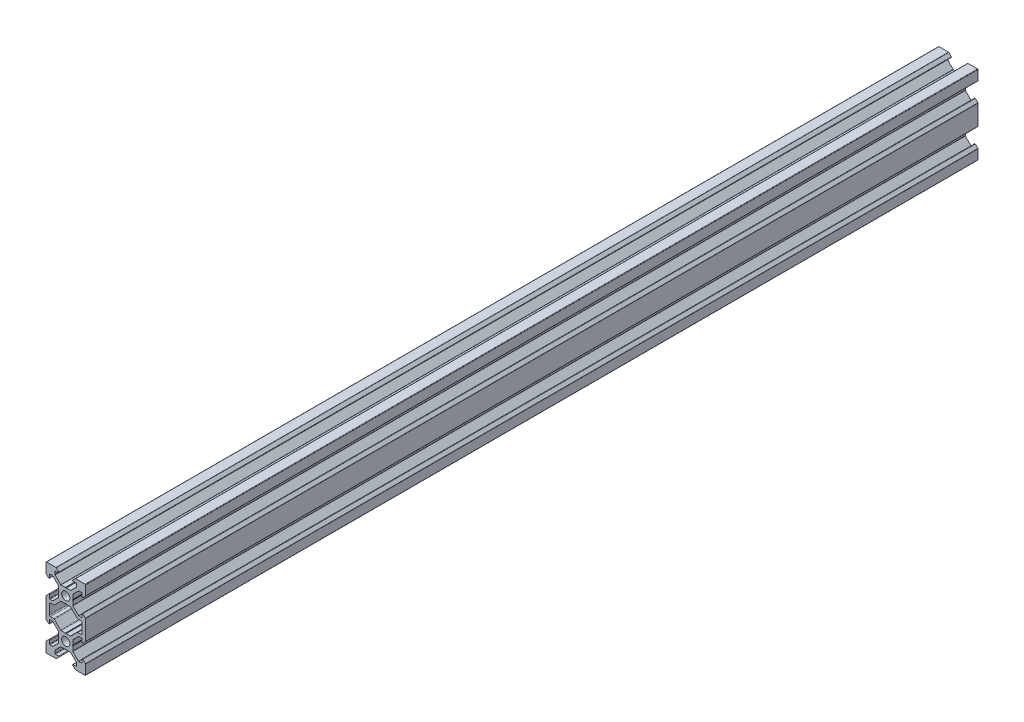
from build123d import *

# Parameters (mm, degrees)
SKETCH1_R           = 2.1
BOSS_EXTRUDE1_DEPTH = 452
FILLET1_R           = 0.25
FILLET2_R           = 0.5
CUT_EXTRUDE1_DEPTH  = 454.104844379


with BuildPart() as part:
    # Sketch1 → Boss-Extrude1 (new body)
    with BuildSketch(Plane.XY):
        Polygon((3.560660172, -2.5), (3.560660172, 2.5), (6.560660172, 5.5), (8.252142372, 5.5), (8.252142372, 3.1), (10, 4.847857628), (10, 10), (4.847857628, 10), (3.1, 8.252142372), (5.5, 8.252142372), (5.5, 6.560660172), (2.5, 3.560660172), (-2.5, 3.560660172), (-5.5, 6.560660172), (-5.5, 8.252142372), (-3.1, 8.252142372), (-4.847857628, 10), (-10, 10), (-10, 4.847857628), (-8.252142372, 3.1), (-8.252142372, 5.5), (-6.560660172, 5.5), (-3.560660172, 2.5), (-3.560660172, -2.5), (-6.560660172, -5.5), (-8.252142372, -5.5), (-8.252142372, -3.1), (-10, -4.847857628), (-10, -7), (-10, -13), (-10, -15.152142372), (-8.252142372, -16.9), (-8.252142372, -14.5), (-6.560660172, -14.5), (-3.560660172, -17.5), (-3.560660172, -22.5), (-6.560660172, -25.5), (-8.252142372, -25.5), (-8.252142372, -23.1), (-10, -24.847857628), (-10, -30), (-4.847857628, -30), (-3.1, -28.252142372), (-5.5, -28.252142372), (-5.5, -26.560660172), (-2.5, -23.560660172), (2.5, -23.560660172), (5.5, -26.560660172), (5.5, -28.252142372), (3.1, -28.252142372), (4.847857628, -30), (10, -30), (10, -24.847857628), (8.252142372, -23.1), (8.252142372, -25.5), (6.560660172, -25.5), (3.560660172, -22.5), (3.560660172, -17.5), (6.560660172, -14.5), (8.252142372, -14.5), (8.252142372, -16.9), (10, -15.152142372), (10, -13), (10, -7), (10, -4.847857628), (8.252142372, -3.1), (8.252142372, -5.5), (6.560660172, -5.5), align=None)
        Circle(SKETCH1_R, mode=Mode.SUBTRACT)
        with Locations((0, -20)):
            Circle(SKETCH1_R, mode=Mode.SUBTRACT)
        Polygon((2.5, -3.560660172), (-2.5, -3.560660172), (-5.5, -6.560660172), (-5.939339828, -7), (-8.252142372, -7), (-8.252142372, -13), (-5.939339828, -13), (-5.5, -13.439339828), (-2.5, -16.439339828), (2.5, -16.439339828), (5.5, -13.439339828), (5.939339828, -13), (8.252142372, -13), (8.252142372, -7), (5.939339828, -7), (5.5, -6.560660172), align=None, mode=Mode.SUBTRACT)
    extrude(amount=BOSS_EXTRUDE1_DEPTH)

    # Fillet1
    fillet1_edges = [part.edges().sort_by_distance(p)[0] for p in [
        (5.5, 6.560660172, 226),
        (5.5, 8.252142372, 226),
        (3.1, 8.252142372, 226),
        (4.847857628, 10, 226),
        (10, 10, 226),
        (10, 4.847857628, 226),
        (8.252142372, 3.1, 226),
        (8.252142372, 5.5, 226),
        (6.560660172, 5.5, 226),
        (3.560660172, 2.5, 226),
        (3.560660172, -2.5, 226),
        (6.560660172, -5.5, 226),
        (8.252142372, -5.5, 226),
        (8.252142372, -3.1, 226),
        (10, -4.847857628, 226),
        (10, -15.152142372, 226),
        (8.252142372, -16.9, 226),
        (8.252142372, -14.5, 226),
        (6.560660172, -14.5, 226),
        (3.560660172, -17.5, 226),
        (3.560660172, -22.5, 226),
        (6.560660172, -25.5, 226),
        (8.252142372, -25.5, 226),
        (8.252142372, -23.1, 226),
        (10, -24.847857628, 226),
        (10, -30, 226),
        (4.847857628, -30, 226),
        (3.1, -28.252142372, 226),
        (5.5, -28.252142372, 226),
        (5.5, -26.560660172, 226),
        (2.5, -23.560660172, 226),
        (-2.5, -23.560660172, 226),
        (-5.5, -26.560660172, 226),
        (-5.5, -28.252142372, 226),
        (-3.1, -28.252142372, 226),
        (-4.847857628, -30, 226),
        (-10, -30, 226),
        (-10, -24.847857628, 226),
        (-8.252142372, -23.1, 226),
        (-8.252142372, -25.5, 226),
        (-6.560660172, -25.5, 226),
        (-3.560660172, -22.5, 226),
        (-3.560660172, -17.5, 226),
        (-6.560660172, -14.5, 226),
        (-8.252142372, -14.5, 226),
        (-8.252142372, -16.9, 226),
        (-10, -15.152142372, 226),
        (-10, -4.847857628, 226),
        (-8.252142372, -3.1, 226),
        (-8.252142372, -5.5, 226),
        (-6.560660172, -5.5, 226),
        (-3.560660172, -2.5, 226),
        (-3.560660172, 2.5, 226),
        (-6.560660172, 5.5, 226),
        (-8.252142372, 5.5, 226),
        (-8.252142372, 3.1, 226),
        (-10, 4.847857628, 226),
        (-10, 10, 226),
        (-4.847857628, 10, 226),
        (-5.5, 8.252142372, 226),
        (-5.5, 6.560660172, 226),
        (-2.5, 3.560660172, 226),
        (2.5, 3.560660172, 226),
        (-3.1, 8.252142372, 226),
    ]]
    fillet(fillet1_edges, radius=FILLET1_R)

    # Fillet2
    fillet2_edges = [part.edges().sort_by_distance(p)[0] for p in [
        (-5.939339828, -7, 226),
        (-8.252142372, -7, 226),
        (-8.252142372, -13, 226),
        (-5.939339828, -13, 226),
        (-2.5, -16.439339828, 226),
        (2.5, -16.439339828, 226),
        (8.252142372, -7, 226),
        (5.939339828, -7, 226),
        (2.5, -3.560660172, 226),
        (-2.5, -3.560660172, 226),
        (5.939339828, -13, 226),
        (8.252142372, -13, 226),
    ]]
    fillet(fillet2_edges, radius=FILLET2_R)

    # Sketch2 → Cut-Extrude1 (cut, through all)
    with BuildSketch(Plane.XY.offset(452)):
        Polygon((0, 3.398953432), (-0.242280927, 3.560660172), (0.242280927, 3.560660172), align=None)
        Polygon((0, -3.398953432), (0.242280927, -3.560660172), (-0.242280927, -3.560660172), align=None)
        Polygon((3.560660172, 0.242280927), (3.560660172, -0.242280927), (3.398953432, 0), align=None)
        Polygon((-3.560660172, 0.242280927), (-3.560660172, -0.242280927), (-3.398953432, 0), align=None)
        Polygon((-3.398953432, -20), (-3.560660172, -20.242280927), (-3.560660172, -19.757719073), align=None)
        Polygon((3.398953432, -20), (3.560660172, -19.757719073), (3.560660172, -20.242280927), align=None)
        Polygon((-0.242280927, -16.439339828), (0.242280927, -16.439339828), (0, -16.601046568), align=None)
        Polygon((-0.242280927, -23.560660172), (0.242280927, -23.560660172), (0, -23.398953432), align=None)
    extrude(amount=-CUT_EXTRUDE1_DEPTH, mode=Mode.SUBTRACT)


solid = part.part
